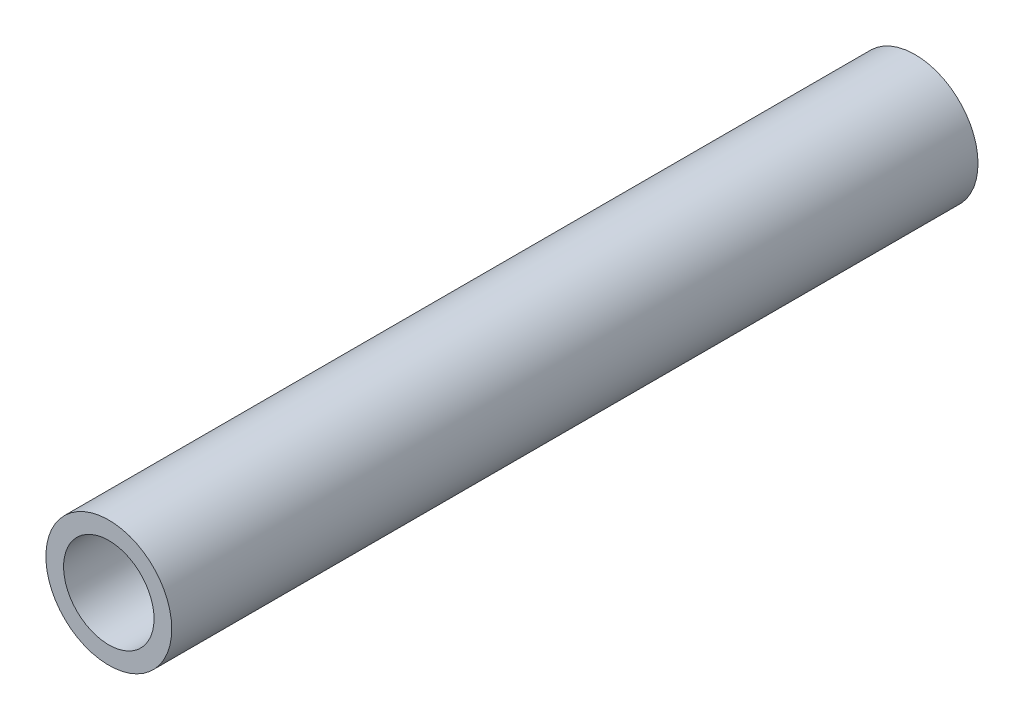
from build123d import *

# Parameters (mm, degrees)
SCHIZZO1_R                = 3.2
SCHIZZO1_R_2              = 2.3
ESTRUSIONE_SOTTILE1_DEPTH = 41


with BuildPart() as part:
    # Schizzo1 → Estrusione-Sottile1 (new body)
    with BuildSketch(Plane.XY):
        Circle(SCHIZZO1_R)
        Circle(SCHIZZO1_R_2, mode=Mode.SUBTRACT)
    extrude(amount=ESTRUSIONE_SOTTILE1_DEPTH)


solid = part.part
